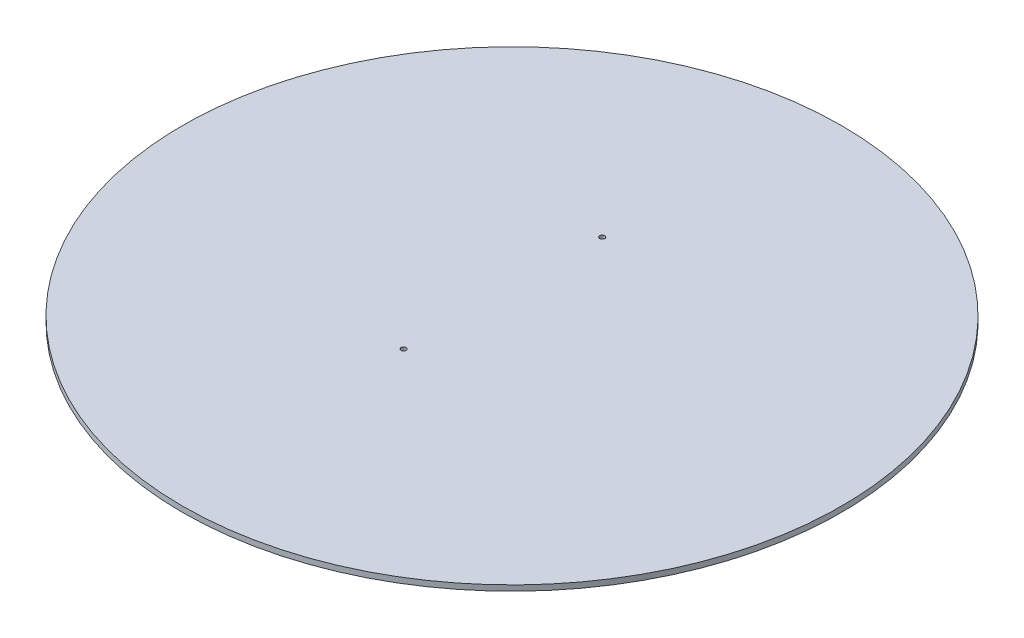
from build123d import *

# Parameters (mm, degrees)
SKETCH2_R           = 304.8
BOSS_EXTRUDE1_DEPTH = 5.08
SKETCH3_R           = 2.3495
CUT_EXTRUDE1_DEPTH  = 551.375550873


with BuildPart() as part:
    # Sketch2 → Boss-Extrude1 (new body)
    with BuildSketch(Plane(origin=(0, 0, 0), x_dir=(1, 0, 0), z_dir=(0, 1, 0))):
        Circle(SKETCH2_R)
    extrude(amount=BOSS_EXTRUDE1_DEPTH)

    # Sketch3 → Cut-Extrude1 (cut, through all)
    with BuildSketch(Plane(origin=(-66.322350069, 82.893676951, -93.082000849), x_dir=(0.9941524009920281, -0.10798438315632809, -0.0006136742891854778), z_dir=(0.10794896477866955, 0.99364514955026, 0.031880052987017425))):
        with Locations((50.826368008, -172.031695999)):
            Circle(SKETCH3_R)
        with Locations((53.154651953, 9.308132583)):
            Circle(SKETCH3_R)
    extrude(amount=-CUT_EXTRUDE1_DEPTH, mode=Mode.SUBTRACT)


solid = part.part
